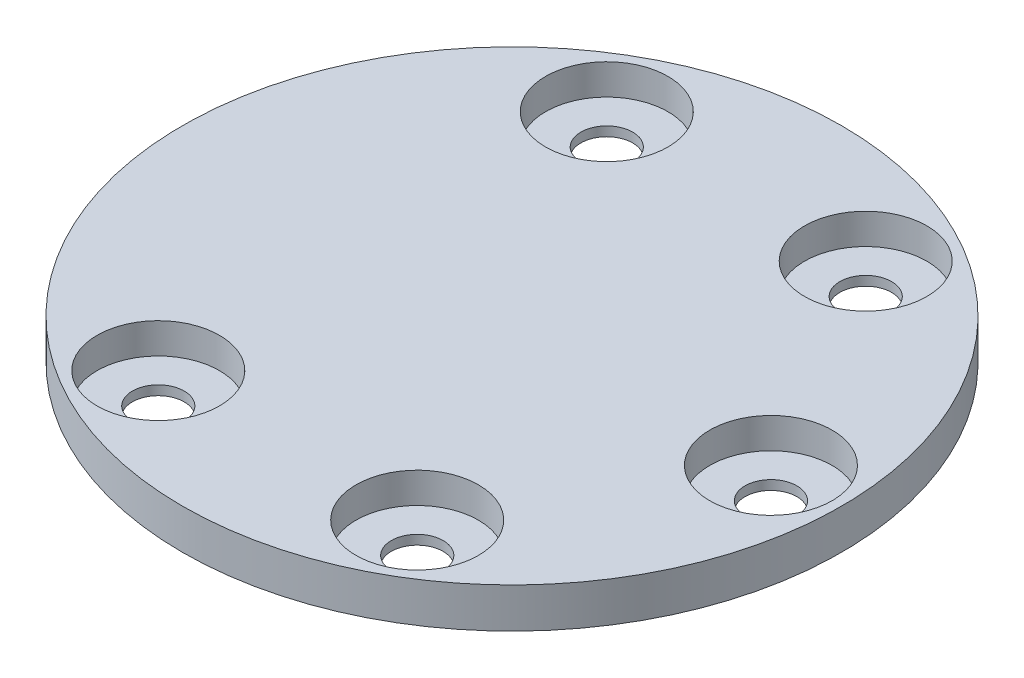
from build123d import *

# Parameters (mm, degrees)
SKETCH1_R           = 14
BOSS_EXTRUDE1_DEPTH = 1.7
CIRPATTERN1_COUNT   = 6
SKETCH8_W           = 1.8
SKETCH8_H           = 0.8
BOSS_EXTRUDE2_DEPTH = 1
FILLET1_R           = 0.25


with BuildPart() as part:
    # Sketch1 → Boss-Extrude1 (new body)
    with BuildSketch(Plane(origin=(0, 0, 0), x_dir=(1, 0, 0), z_dir=(0, 1, 0))):
        Circle(SKETCH1_R)
    extrude(amount=BOSS_EXTRUDE1_DEPTH)

    # Sketch7 → CBORE for M5 Hex Head Bolt1 (revolve, cut)
    with BuildSketch(Plane(origin=(11, 1.7, 0), x_dir=(0, 0, 1), z_dir=(1, 0, 0))):
        Polygon((0, 0), (0, 5.660946681), (1.1, 5), (1.1, 1.3), (2.6, 1.3), (2.6, 0), align=None)
    cbore_for_m5_hex_head_bolt1 = revolve(axis=Axis((11, 8.05, 0), (0, -1, 0)), mode=Mode.SUBTRACT)

    # CirPattern1: CBORE for M5 Hex Head Bolt1 ×6 about axis, 1 skipped
    cirpattern1_axis = Axis((0, 1.7, 0), (0, 1, 0))
    add([cbore_for_m5_hex_head_bolt1.rotate(cirpattern1_axis, i * 360 / CIRPATTERN1_COUNT) for i in range(1, CIRPATTERN1_COUNT) if i not in (3,)], mode=Mode.SUBTRACT)

    # Sketch8 → Boss-Extrude2 (add)
    with BuildSketch(Plane.XZ):
        with Locations((4, 0)):
            Rectangle(SKETCH8_W, SKETCH8_H)
    extrude(amount=BOSS_EXTRUDE2_DEPTH)

    # Fillet1
    fillet1_edges = [part.edges().sort_by_distance(p)[0] for p in [
        (3.1, 0, 0),
        (4.9, 0, 0),
        (4.9, -0.5, 0.4),
        (3.1, -0.5, 0.4),
        (4, 0, 0.4),
        (3.1, -0.5, -0.4),
        (4.9, -0.5, -0.4),
        (4, 0, -0.4),
        (4, -1, 0.4),
        (4.9, -1, 0),
        (4, -1, -0.4),
        (3.1, -1, 0),
    ]]
    fillet(fillet1_edges, radius=FILLET1_R)


solid = part.part
